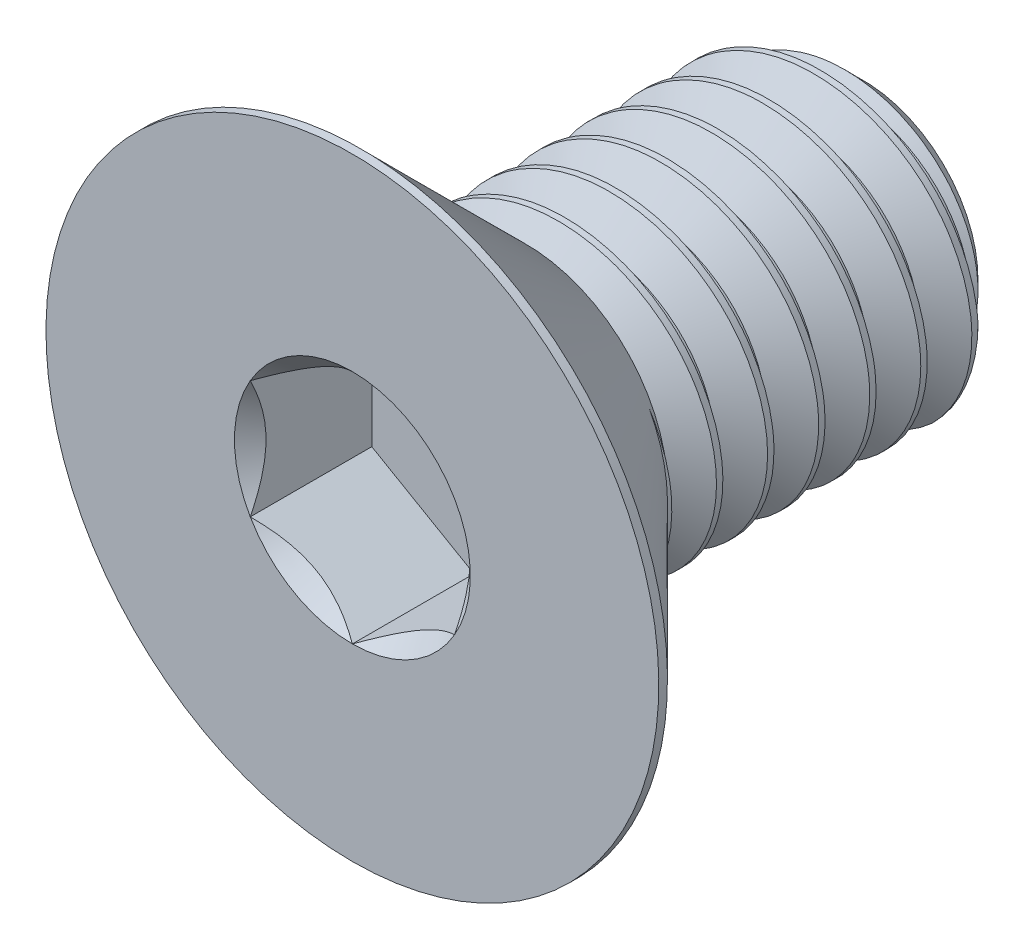
from build123d import *

# Parameters (mm, degrees)
CHAMFER1_SIZE      = 0.375
CUT_EXTRUDE2_DEPTH = 1.19
CUT_SWEEP1_PITCH   = 0.5


with BuildPart() as part:
    # Sketch1 → Revolve1 (revolve)
    with BuildSketch(Plane(origin=(0, 0, 0), x_dir=(0, 0, -1), z_dir=(1, 0, 0)), mode=Mode.PRIVATE) as revolve1_sk:
        Polygon((-0.8, 1.5), (2.5, 1.5), (2.5, 0), (-1.31, 0), (-1.31, 1.5), align=None)
    revolve(revolve1_sk.sketch.rotate(Axis((0, 0, 1.31), (0, 0, -1)), 180), axis=Axis((0, 0, 1.31), (0, 0, -1)))

    # Chamfer1
    chamfer1_edges = [part.edges().sort_by_distance(p)[0] for p in [
        (0, 1.5, -2.5),
    ]]
    chamfer(chamfer1_edges, length=CHAMFER1_SIZE)

    # Cut-Sweep1: the profile of Sketch13 screwed along a right-hand helix of 10 turns, 6 arcs to a turn; built about Z, then put on its axis
    cut_sweep1_z = Axis((0, 0, 0), (0, 0, 1))
    cut_sweep1_corners = [(1.527063294, 0, 0.015625), (1.527063294, 0, -0.453125), (1.175240474, 0, -0.25), (1.175240474, 0, -0.1875)]
    with BuildLine(mode=Mode.PRIVATE) as cut_sweep1_profile:
        Line(cut_sweep1_corners[0], cut_sweep1_corners[1])
        Line(cut_sweep1_corners[1], cut_sweep1_corners[2])
        Line(cut_sweep1_corners[2], cut_sweep1_corners[3])
        Line(cut_sweep1_corners[3], cut_sweep1_corners[0])
    cut_sweep1_cap = Face(cut_sweep1_profile.wire())
    cut_sweep1_turn_angles = [0, 30, 60, 90, 120, 150, 180, 210, 240, 270, 300, 330, 360]
    cut_sweep1_turn_weights = [1, 0.8660254037844387, 1, 0.8660254037844387, 1, 0.8660254037844387, 1, 0.8660254037844387, 1, 0.8660254037844387, 1, 0.8660254037844387, 1]
    cut_sweep1_turn_rails = [Edge.make_bspline([Vector(p[0], p[1], 0).rotate(cut_sweep1_z, cut_sweep1_turn_angles[k]) / cut_sweep1_turn_weights[k] + Vector(0, 0, p[2] + CUT_SWEEP1_PITCH * cut_sweep1_turn_angles[k] / 360) for k in range(13)], [0, 0, 0, 1, 1, 2, 2, 3, 3, 4, 4, 5, 5, 6, 6, 6], 2, cut_sweep1_turn_weights) for p in cut_sweep1_corners]
    cut_sweep1_turn_sides = [Face.make_surface_from_curves(cut_sweep1_turn_rails[p[0]], cut_sweep1_turn_rails[p[1]]) for p in [(0, 1), (1, 2), (2, 3), (3, 0)]]
    cut_sweep1 = Plane(origin=(0, 0, -2.5), x_dir=(0, 1, 0), z_dir=(0, 0, 1)) * Solid(Shell([*[p.moved(Location((0, 0, CUT_SWEEP1_PITCH * i))) for i in range(10) for p in cut_sweep1_turn_sides], cut_sweep1_cap, cut_sweep1_cap.rotate(cut_sweep1_z, 3600).moved(Location((0, 0, CUT_SWEEP1_PITCH * 3600 / 360)))]))
    add(cut_sweep1, mode=Mode.SUBTRACT)


with BuildPart() as body_2:
    # Sketch7 → Revolve2 (revolve)
    with BuildSketch(Plane(origin=(0, 0, 0), x_dir=(0, 0, -1), z_dir=(1, 0, 0)), mode=Mode.PRIVATE) as revolve2_sk:
        Polygon((-2.5, 3), (-2.415, 3), (-0.8, 1.385), (-0.8, 0), (-2.5, 0), align=None)
    revolve(revolve2_sk.sketch.rotate(Axis((0, 0, 2.5), (0, 0, -1)), 180), axis=Axis((0, 0, 2.5), (0, 0, -1)))

    # Sketch5 → Cut-Extrude2 (cut)
    with BuildSketch(Plane.XY.offset(2.5)):
        Polygon((1, -0.577350269), (1, 0.577350269), (0, 1.154700538), (-1, 0.577350269), (-1, -0.577350269), (0, -1.154700538), align=None)
    extrude(amount=-CUT_EXTRUDE2_DEPTH, mode=Mode.SUBTRACT)

    # Cut-Extrude3 cone 1 section (through the dimple's axis) → Cut-Extrude3 (revolve, cut)
    with BuildSketch(Plane(origin=(0, 0, 2.5), x_dir=(0, -1, 0), z_dir=(1, 0, 0))):
        Polygon((0, 0), (1.154700538, 0), (0, 1.154700538), align=None)
    revolve(axis=Axis((0, 0, 2.5), (0, 0, -1)), mode=Mode.SUBTRACT)

    # Combine1: union part
    add(part.part)


solid = body_2.part
